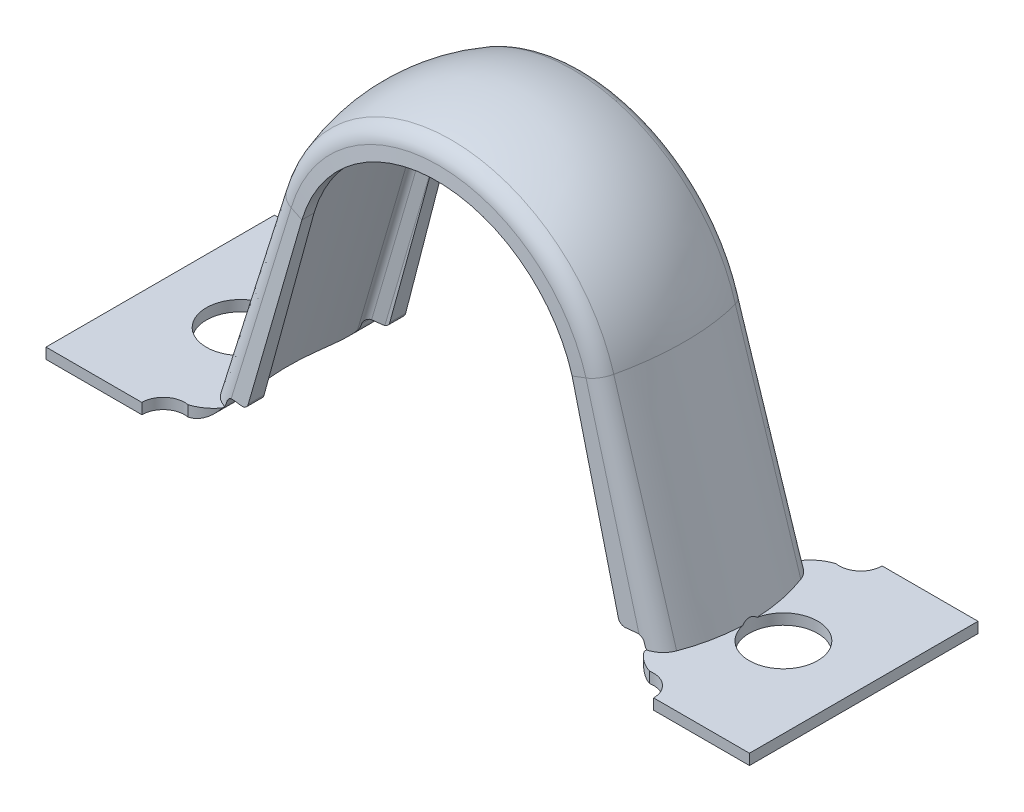
from build123d import *

# Parameters (mm, degrees)
CORTAR_EXTRUIR1_DEPTH        = 16
CORTAR_EXTRUIR1_DEPTH_BACK   = 16
SALIENTE_EXTRUIR1_DEPTH      = 34
SALIENTE_EXTRUIR1_DRAFT      = 1
SALIENTE_EXTRUIR2_DEPTH      = 34
SALIENTE_EXTRUIR2_DRAFT      = 1
SALIENTE_EXTRUIR3_DEPTH      = 16
SALIENTE_EXTRUIR3_DEPTH_BACK = 16
CROQUIS5_W                   = 40
CROQUIS5_H                   = 1.5
SALIENTE_EXTRUIR4_DEPTH      = 16
SALIENTE_EXTRUIR4_DEPTH_BACK = 16
CROQUIS6_W                   = 40
CROQUIS6_H                   = 1.5
CROQUIS7_R                   = 4.8
CORTAR_EXTRUIR2_DEPTH        = 49.25
CROQUIS8_R                   = 4.8
CORTAR_EXTRUIR3_DEPTH        = 36
CORTAR_EXTRUIR4_DEPTH        = 46
CORTAR_EXTRUIR5_DEPTH        = 46
CORTAR_EXTRUIR6_DEPTH        = 1.5
CORTAR_EXTRUIR6_DEPTH_BACK   = 1.5
CORTAR_EXTRUIR7_DEPTH        = 1.5
CORTAR_EXTRUIR8_DEPTH        = 1.5
CORTAR_EXTRUIR9_DEPTH        = 1.5
CORTAR_EXTRUIR9_DEPTH_BACK   = 1.5
CORTAR_EXTRUIR10_DEPTH       = 34
CORTAR_EXTRUIR10_DEPTH_BACK  = 34
CORTAR_EXTRUIR11_DEPTH       = 26
CORTAR_EXTRUIR11_DEPTH_BACK  = 26
REDONDEO1_R                  = 1


with BuildPart() as part:
    # Croquis1 → Revolución1 (revolve)
    with BuildSketch(Plane(origin=(0, 0, 0), x_dir=(0, 0, -1), z_dir=(1, 0, 0)), mode=Mode.PRIVATE) as revoluci_n1_sk:
        with BuildLine():
            Line((-10.5, 19.709677419), (-8.8, 19.709677419))
            Line((-8.8, 19.709677419), (-8.60641193, 21.293920434))
            ThreePointArc((-8.60641193, 21.293920434), (-8.395381623, 21.796423767), (-7.952186256, 22.113632306))
            ThreePointArc((-7.952186256, 22.113632306), (-4.5e-08, 23.5), (7.952186172, 22.113632336))
            ThreePointArc((7.952186172, 22.113632336), (8.395381595, 21.796423802), (8.60641193, 21.293920434))
            Line((8.60641193, 21.293920434), (8.8, 19.709677419))
            Line((8.8, 19.709677419), (10.5, 19.709677419))
            Line((10.5, 19.709677419), (10.280634612, 21.504871123))
            ThreePointArc((10.280634612, 21.504871123), (9.710326674, 22.862289099), (8.512638142, 23.718663366))
            ThreePointArc((8.512638142, 23.718663366), (8.2e-08, 25.2), (-8.512637989, 23.718663421))
            ThreePointArc((-8.512637989, 23.718663421), (-9.710326623, 22.862289162), (-10.280634612, 21.504871123))
            Line((-10.280634612, 21.504871123), (-10.5, 19.709677419))
        make_face()
    revolve(revoluci_n1_sk.sketch.rotate(Axis((0, 0, -16), (0, 0, 1)), 270), axis=Axis((0, 0, -16), (0, 0, 1)))

    # Croquis2 → Cortar-Extruir1 (cut, two sides: drawn at the far end of the back side and taken through both)
    with BuildSketch(Plane.XY.offset(-CORTAR_EXTRUIR1_DEPTH_BACK)):
        with BuildLine():
            Line((-49.25, -23.8), (-49.25, -25.3))
            Line((-49.25, -25.3), (-32.12605042, -25.3))
            ThreePointArc((-32.12605042, -25.3), (-29.427107301, -24.400792418), (-27.806790899, -22.062536016))
            Line((-27.806790899, -22.062536016), (-25.620602595, -14.583371443))
            ThreePointArc((-25.620602595, -14.583371443), (-23.591838335, -12.812435443), (-21.132793292, -13.910249735))
            ThreePointArc((-21.132793292, -13.910249735), (0, -25.3), (21.132793292, -13.910249735))
            ThreePointArc((21.132793292, -13.910249735), (23.591838335, -12.812435443), (25.620602595, -14.583371443))
            Line((25.620602595, -14.583371443), (27.806790899, -22.062536016))
            ThreePointArc((27.806790899, -22.062536016), (29.427107301, -24.400792418), (32.12605042, -25.3))
            Line((32.12605042, -25.3), (49.25, -25.3))
            Line((49.25, -25.3), (49.25, -23.8))
            Line((49.25, -23.8), (32.12605042, -23.8))
            ThreePointArc((32.12605042, -23.8), (30.326755007, -23.200528279), (29.246544073, -21.641690678))
            Line((29.246544073, -21.641690678), (28.41590706, -18.8))
            Line((28.41590706, -18.8), (47.610009982, -13.189433325))
            Line((47.610009982, -13.189433325), (40.31046584, 11.783023005))
            Line((40.31046584, 11.783023005), (0, 0))
            Line((0, 0), (-40.31046584, 11.783023005))
            Line((-40.31046584, 11.783023005), (-47.610009982, -13.189433325))
            Line((-47.610009982, -13.189433325), (-28.41590706, -18.8))
            Line((-28.41590706, -18.8), (-29.246544073, -21.641690678))
            ThreePointArc((-29.246544073, -21.641690678), (-30.326755007, -23.200528279), (-32.12605042, -23.8))
            Line((-32.12605042, -23.8), (-49.25, -23.8))
        make_face()
    extrude(amount=CORTAR_EXTRUIR1_DEPTH + CORTAR_EXTRUIR1_DEPTH_BACK, mode=Mode.SUBTRACT)


with BuildPart() as saliente_extruir1_tool:
    # Croquis3 → Saliente-Extruir1 (with draft: the straight prism first)
    with BuildSketch(Plane(origin=(0, 0, 0), x_dir=(0.9598346780614391, -0.28056619680690975, 0), z_dir=(0.2805661968069098, 0.9598346780614392, 0))):
        with BuildLine():
            Line((-21.504871123, -10.280634612), (-19.709677419, -10.5))
            Line((-19.709677419, -10.5), (-19.709677419, -8.8))
            Line((-19.709677419, -8.8), (-21.293920434, -8.60641193))
            ThreePointArc((-21.293920434, -8.60641193), (-21.796423837, -8.395381567), (-22.113632366, -7.952186088))
            ThreePointArc((-22.113632366, -7.952186088), (-23.5, 4.5e-08), (-22.113632336, 7.952186172))
            ThreePointArc((-22.113632336, 7.952186172), (-21.796423802, 8.395381595), (-21.293920434, 8.60641193))
            Line((-21.293920434, 8.60641193), (-19.709677419, 8.8))
            Line((-19.709677419, 8.8), (-19.709677419, 10.5))
            Line((-19.709677419, 10.5), (-21.504871123, 10.280634612))
            ThreePointArc((-21.504871123, 10.280634612), (-22.862289099, 9.710326674), (-23.718663366, 8.512638142))
            ThreePointArc((-23.718663366, 8.512638142), (-25.2, 8.2e-08), (-23.718663421, -8.512637989))
            ThreePointArc((-23.718663421, -8.512637989), (-22.862289162, -9.710326623), (-21.504871123, -10.280634612))
        make_face()
    extrude(amount=-SALIENTE_EXTRUIR1_DEPTH)
    # Saliente-Extruir1: the draft: its side faces are tilted about the plane it starts from
    saliente_extruir1_sides = [saliente_extruir1_tool.faces().sort_by_distance(p)[0] for p in [
        (-26.713643242, -9.902804024, -9.710326674),
        (-28.957459233, -9.246921368, -8.2e-08),
        (-26.713643304, -9.902804006, 9.710326623),
        (-24.549201812, -10.535484958, 10.390317306),
        (-23.687657226, -10.787320293, 9.65),
        (-24.447962918, -10.565077775, 8.703205965),
        (-25.690588802, -10.201849787, 8.395381567),
        (-27.32574028, -9.723883902, -4.5e-08),
        (-25.690588768, -10.201849797, -8.395381595),
        (-24.447962918, -10.565077775, -8.703205965),
        (-23.687657226, -10.787320293, -9.65),
        (-24.549201812, -10.535484958, -10.390317306),
    ]]
    draft(saliente_extruir1_sides, Plane(origin=(0, 0, 0), x_dir=(0.9598346780614391, -0.28056619680690975, 0), z_dir=(0.2805661968069098, 0.9598346780614392, 0)), SALIENTE_EXTRUIR1_DRAFT)


with BuildPart() as part_1:
    add(part.part)

    # Saliente-Extruir1: add saliente_extruir1_tool
    add(saliente_extruir1_tool.part)


with BuildPart() as saliente_extruir2_tool:
    # Croquis4 → Saliente-Extruir2 (with draft: the straight prism first)
    with BuildSketch(Plane(origin=(0, 0, 0), x_dir=(0.9598346780614391, 0.28056619680690975, 0), z_dir=(-0.2805661968069098, 0.9598346780614392, 0))):
        with BuildLine():
            Line((19.709677419, -8.8), (19.709677419, -10.5))
            Line((19.709677419, -10.5), (21.504871123, -10.280634612))
            ThreePointArc((21.504871123, -10.280634612), (22.862289099, -9.710326674), (23.718663366, -8.512638142))
            ThreePointArc((23.718663366, -8.512638142), (25.2, -8.2e-08), (23.718663421, 8.512637989))
            ThreePointArc((23.718663421, 8.512637989), (22.862289162, 9.710326623), (21.504871123, 10.280634612))
            Line((21.504871123, 10.280634612), (19.709677419, 10.5))
            Line((19.709677419, 10.5), (19.709677419, 8.8))
            Line((19.709677419, 8.8), (21.293920434, 8.60641193))
            ThreePointArc((21.293920434, 8.60641193), (21.796423767, 8.395381623), (22.113632306, 7.952186256))
            ThreePointArc((22.113632306, 7.952186256), (23.5, 4.5e-08), (22.113632336, -7.952186172))
            ThreePointArc((22.113632336, -7.952186172), (21.796423802, -8.395381595), (21.293920434, -8.60641193))
            Line((21.293920434, -8.60641193), (19.709677419, -8.8))
        make_face()
    extrude(amount=-SALIENTE_EXTRUIR2_DEPTH)
    # Saliente-Extruir2: the draft: its side faces are tilted about the plane it starts from
    saliente_extruir2_sides = [saliente_extruir2_tool.faces().sort_by_distance(p)[0] for p in [
        (25.690588768, -10.201849797, 8.395381595),
        (24.447962918, -10.565077775, 8.703205965),
        (23.687657226, -10.787320293, 9.65),
        (24.549201812, -10.535484958, 10.390317306),
        (26.713643242, -9.902804024, 9.710326674),
        (28.957459233, -9.246921368, 8.2e-08),
        (26.713643304, -9.902804006, -9.710326623),
        (24.549201812, -10.535484958, -10.390317306),
        (23.687657226, -10.787320293, -9.65),
        (24.447962918, -10.565077775, -8.703205965),
        (25.690588735, -10.201849807, -8.395381623),
        (27.32574028, -9.723883902, -4.5e-08),
    ]]
    draft(saliente_extruir2_sides, Plane(origin=(0, 0, 0), x_dir=(0.9598346780614391, 0.28056619680690975, 0), z_dir=(-0.2805661968069098, 0.9598346780614392, 0)), SALIENTE_EXTRUIR2_DRAFT)


with BuildPart() as part_2:
    add(part_1.part)

    # Saliente-Extruir2: add saliente_extruir2_tool
    add(saliente_extruir2_tool.part)

    # Croquis5 → Saliente-Extruir3 (add, two sides: drawn at the far end of the back side and taken through both)
    with BuildSketch(Plane.XY.offset(-SALIENTE_EXTRUIR3_DEPTH_BACK)):
        with Locations((-29.25, -23.05)):
            Rectangle(CROQUIS5_W, CROQUIS5_H)
    extrude(amount=SALIENTE_EXTRUIR3_DEPTH + SALIENTE_EXTRUIR3_DEPTH_BACK)

    # Croquis6 → Saliente-Extruir4 (add, two sides: drawn at the far end of the back side and taken through both)
    with BuildSketch(Plane.XY.offset(-SALIENTE_EXTRUIR4_DEPTH_BACK)):
        with Locations((29.25, -23.05)):
            Rectangle(CROQUIS6_W, CROQUIS6_H)
    extrude(amount=SALIENTE_EXTRUIR4_DEPTH + SALIENTE_EXTRUIR4_DEPTH_BACK)

    # Croquis7 → Cortar-Extruir2 (cut)
    with BuildSketch(Plane(origin=(0, 0, 0), x_dir=(1, 0, 0), z_dir=(0, 1, 0))):
        with Locations(Location((-38, 0, 0), (0, 0, 323.445959754))):
            Circle(CROQUIS7_R)
    extrude(amount=-CORTAR_EXTRUIR2_DEPTH, mode=Mode.SUBTRACT)

    # Croquis8 → Cortar-Extruir3 (cut)
    with BuildSketch(Plane(origin=(0, 0, 0), x_dir=(1, 0, 0), z_dir=(0, 1, 0))):
        with Locations(Location((38, 0, 0), (0, 0, 216.554151026))):
            Circle(CROQUIS8_R)
    extrude(amount=-CORTAR_EXTRUIR3_DEPTH, mode=Mode.SUBTRACT)

    # Croquis9 → Cortar-Extruir4 (cut)
    with BuildSketch(Plane(origin=(0, 0, 0), x_dir=(0.9598346780614391, 0.28056619680690975, 0), z_dir=(-0.2805661968069098, 0.9598346780614392, 0))):
        with BuildLine():
            Line((14.709677419, 8.8), (14.709677419, -8.8))
            Line((14.709677419, -8.8), (19.709677419, -8.8))
            Line((19.709677419, -8.8), (21.293920434, -8.60641193))
            ThreePointArc((21.293920434, -8.60641193), (21.796423767, -8.395381623), (22.113632306, -7.952186256))
            ThreePointArc((22.113632306, -7.952186256), (23.5, -4.5e-08), (22.113632336, 7.952186172))
            ThreePointArc((22.113632336, 7.952186172), (21.796423802, 8.395381595), (21.293920434, 8.60641193))
            Line((21.293920434, 8.60641193), (19.709677419, 8.8))
            Line((19.709677419, 8.8), (14.709677419, 8.8))
        make_face()
    extrude(amount=-CORTAR_EXTRUIR4_DEPTH, mode=Mode.SUBTRACT)

    # Croquis10 → Cortar-Extruir5 (cut)
    with BuildSketch(Plane(origin=(0, 0, 0), x_dir=(0.9598346780614391, -0.28056619680690975, 0), z_dir=(0.2805661968069098, 0.9598346780614392, 0))):
        with BuildLine():
            Line((-21.293920434, -8.60641193), (-19.709677419, -8.8))
            Line((-19.709677419, -8.8), (-14.709677419, -8.8))
            Line((-14.709677419, -8.8), (-14.709677419, 8.8))
            Line((-14.709677419, 8.8), (-19.709677419, 8.8))
            Line((-19.709677419, 8.8), (-21.293920434, 8.60641193))
            ThreePointArc((-21.293920434, 8.60641193), (-21.796423767, 8.395381623), (-22.113632306, 7.952186256))
            ThreePointArc((-22.113632306, 7.952186256), (-23.5, 4.5e-08), (-22.113632336, -7.952186172))
            ThreePointArc((-22.113632336, -7.952186172), (-21.796423802, -8.395381595), (-21.293920434, -8.60641193))
        make_face()
    extrude(amount=-CORTAR_EXTRUIR5_DEPTH, mode=Mode.SUBTRACT)

    # Croquis11 → Cortar-Extruir6 (cut, two sides: drawn at the far end of the back side and taken through both)
    with BuildSketch(Plane(origin=(0, -23.8, 0), x_dir=(1, 0, 0), z_dir=(0, 1, 0)).offset(-CORTAR_EXTRUIR6_DEPTH_BACK)):
        with BuildLine():
            Line((-35.833333333, -16), (-28.465517241, -16))
            Line((-28.465517241, -16), (-28.465517241, -7.794871795))
            ThreePointArc((-28.465517241, -7.794871795), (-29.533494545, -11.051737592), (-32.322671722, -13.043782025))
            ThreePointArc((-32.322671722, -13.043782025), (-34.76569137, -13.705224975), (-35.833333333, -16))
        make_face()
    extrude(amount=CORTAR_EXTRUIR6_DEPTH + CORTAR_EXTRUIR6_DEPTH_BACK, mode=Mode.SUBTRACT)

    # Croquis12 → Cortar-Extruir7 (cut)
    with BuildSketch(Plane(origin=(0, -23.8, 0), x_dir=(1, 0, 0), z_dir=(0, 1, 0))):
        with BuildLine():
            Line((-28.465517241, 7.794871795), (-28.465517241, 16))
            Line((-28.465517241, 16), (-35.833333333, 16))
            ThreePointArc((-35.833333333, 16), (-34.76569137, 13.705224975), (-32.322671722, 13.043782025))
            ThreePointArc((-32.322671722, 13.043782025), (-29.533494545, 11.051737592), (-28.465517241, 7.794871795))
        make_face()
    extrude(amount=CORTAR_EXTRUIR7_DEPTH, mode=Mode.SUBTRACT)

    # Croquis13 → Cortar-Extruir8 (cut)
    with BuildSketch(Plane(origin=(0, -23.8, 0), x_dir=(1, 0, 0), z_dir=(0, 1, 0))):
        with BuildLine():
            Line((35.833333333, 16), (28.465517241, 16))
            Line((28.465517241, 16), (28.465517241, 7.794871795))
            ThreePointArc((28.465517241, 7.794871795), (29.533494545, 11.051737592), (32.322671722, 13.043782025))
            ThreePointArc((32.322671722, 13.043782025), (34.76569137, 13.705224975), (35.833333333, 16))
        make_face()
    extrude(amount=CORTAR_EXTRUIR8_DEPTH, mode=Mode.SUBTRACT)

    # Croquis14 → Cortar-Extruir9 (cut, two sides: drawn at the far end of the back side and taken through both)
    with BuildSketch(Plane(origin=(0, -23.8, 0), x_dir=(1, 0, 0), z_dir=(0, 1, 0)).offset(-CORTAR_EXTRUIR9_DEPTH_BACK)):
        with BuildLine():
            Line((28.465517241, -7.794871795), (28.465517241, -16))
            Line((28.465517241, -16), (35.833333333, -16))
            ThreePointArc((35.833333333, -16), (34.76569137, -13.705224975), (32.322671722, -13.043782025))
            ThreePointArc((32.322671722, -13.043782025), (29.533494545, -11.051737592), (28.465517241, -7.794871795))
        make_face()
    extrude(amount=CORTAR_EXTRUIR9_DEPTH + CORTAR_EXTRUIR9_DEPTH_BACK, mode=Mode.SUBTRACT)

    # Croquis15 → Cortar-Extruir10 (cut, two sides: drawn at the far end of the back side and taken through both)
    with BuildSketch(Plane.XY.offset(-CORTAR_EXTRUIR10_DEPTH_BACK)):
        with BuildLine():
            Line((-49.25, -32.3), (-0.62605042, -32.3))
            Line((-0.62605042, -32.3), (-0.62605042, -20.8))
            Line((-0.62605042, -20.8), (-28.253067074, -20.8))
            ThreePointArc((-28.253067074, -20.8), (-28.865439524, -21.009430596), (-29.22131292, -21.550000035))
            ThreePointArc((-29.22131292, -21.550000035), (-30.288933128, -23.171708256), (-32.12605042, -23.8))
            Line((-32.12605042, -23.8), (-49.25, -23.8))
            Line((-49.25, -23.8), (-49.25, -32.3))
        make_face()
    extrude(amount=CORTAR_EXTRUIR10_DEPTH + CORTAR_EXTRUIR10_DEPTH_BACK, mode=Mode.SUBTRACT)

    # Croquis16 → Cortar-Extruir11 (cut, two sides: drawn at the far end of the back side and taken through both)
    with BuildSketch(Plane.XY.offset(-CORTAR_EXTRUIR11_DEPTH_BACK)):
        with BuildLine():
            Line((0.62605042, -32.3), (49.25, -32.3))
            Line((49.25, -32.3), (49.25, -23.8))
            Line((49.25, -23.8), (32.12605042, -23.8))
            ThreePointArc((32.12605042, -23.8), (30.28893313, -23.171708258), (29.221312921, -21.550000041))
            ThreePointArc((29.221312921, -21.550000041), (28.865439526, -21.009430598), (28.253067074, -20.8))
            Line((28.253067074, -20.8), (0.62605042, -20.8))
            Line((0.62605042, -20.8), (0.62605042, -32.3))
        make_face()
    extrude(amount=CORTAR_EXTRUIR11_DEPTH + CORTAR_EXTRUIR11_DEPTH_BACK, mode=Mode.SUBTRACT)

    # Redondeo1
    # the kernel refuses this fillet: 1 mm, written as the material it takes off along each edge
    with BuildSketch(Plane(origin=(26.118105486, -20.8, -12.946294335), x_dir=(1, 0, 0), z_dir=(0, 0, 1)), Plane(origin=(-26.118105486, -20.8, 12.946294335), x_dir=(-1, 0, 0), z_dir=(0, 0, -1)), Plane(origin=(26.118105486, -20.8, 6.891853168), x_dir=(1, 0, 0), z_dir=(0, 0, 1)), Plane(origin=(-26.118105486, -20.8, -6.891853168), x_dir=(-1, 0, 0), z_dir=(0, 0, -1))) as redondeo1_piece_1:
        with BuildLine():
            CenterArc((REDONDEO1_R * 0.76325873269, REDONDEO1_R), REDONDEO1_R, 195.294, 74.706)
            Line((-REDONDEO1_R * 0.2013263132, REDONDEO1_R * 0.736227959698), (0, 0))
            Line((0, 0), (REDONDEO1_R * 0.76325873269, 0))
        make_face()
    extrude(amount=6.054441167, mode=Mode.SUBTRACT)


solid = part_2.part
